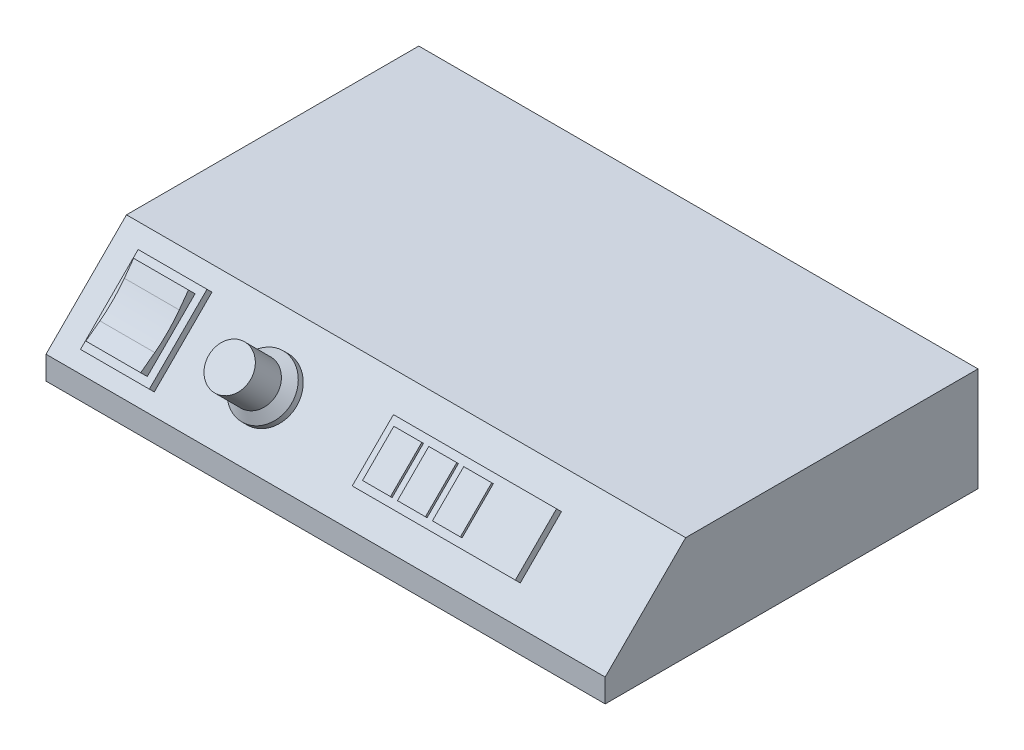
from build123d import *

# Parameters (mm, degrees)
BOSS_EXTRUDE1_DEPTH = 240
SKETCH2_W           = 70
SKETCH2_H           = 25
SKETCH2_W_2         = 29.546106777
SKETCH2_H_2         = 35
SKETCH2_R           = 12.5
BOSS_EXTRUDE2_DEPTH = 3
SKETCH3_R           = 9
BOSS_EXTRUDE3_DEPTH = 20
CHAMFER1_SIZE2      = 4.171137574
CHAMFER1_SIZE       = 3.5
SKETCH4_W           = 23.546106777
SKETCH4_H           = 29
BOSS_EXTRUDE4_DEPTH = 4
CUT_EXTRUDE1_DEPTH  = 27
SKETCH6_W           = 12
SKETCH6_H           = 19
BOSS_EXTRUDE5_DEPTH = 1


with BuildPart() as part:
    # Sketch1 → Boss-Extrude1 (new body)
    with BuildSketch(Plane(origin=(0, 0, 0), x_dir=(0, 0, -1), z_dir=(1, 0, 0))):
        Polygon((0, 0), (-66.758331831, 0), (-66.758331831, 10), (-32.219272119, 44.539059712), (93.241668169, 44.539059712), (93.241668169, 0), align=None)
    extrude(amount=BOSS_EXTRUDE1_DEPTH)

    # Sketch2 → Boss-Extrude2 (add)
    with BuildSketch(Plane(origin=(0, 38.379165915, 38.379165915), x_dir=(1, 0, 0), z_dir=(0, 0.7071067811865298, 0.7071067811865652))):
        with Locations((160.181803508, -15.788594651)):
            Rectangle(SKETCH2_W, SKETCH2_H)
        with Locations((27.103479103, -16.134201326)):
            Rectangle(SKETCH2_W_2, SKETCH2_H_2)
        with Locations(Location((77.833586966, -15.734201326, 0), (0, 0, 90))):
            Circle(SKETCH2_R)
    extrude(amount=BOSS_EXTRUDE2_DEPTH)

    # Sketch3 → Boss-Extrude3 (add)
    with BuildSketch(Plane(origin=(0, 40.500486259, 40.500486259), x_dir=(1, 0, 0), z_dir=(0, 0.7071067811865298, 0.7071067811865652))):
        with Locations(Location((77.833586966, -15.734201326, 0), (0, 0, 90))):
            Circle(SKETCH3_R)
    extrude(amount=BOSS_EXTRUDE3_DEPTH)

    # Chamfer1
    chamfer1_edges = [part.edges().sort_by_distance(p)[0] for p in [
        (77.833586966, 23.010764774, 57.990207744),
    ]]
    chamfer1_side = [part.faces().sort_by_distance(p)[0] for p in [
        (77.833586966, 22.961267299, 58.039705219),
    ]]
    chamfer(chamfer1_edges, length=CHAMFER1_SIZE - 0.0001, length2=CHAMFER1_SIZE2 - 0.0001, reference=chamfer1_side[0])  # a hair under: the kernel refuses the full size

    # Sketch4 → Boss-Extrude4 (add)
    with BuildSketch(Plane(origin=(0, 40.500486259, 40.500486259), x_dir=(1, 0, 0), z_dir=(0, 0.7071067811865298, 0.7071067811865652))):
        with Locations((27.103479102, -16.134201326)):
            Rectangle(SKETCH4_W, SKETCH4_H)
    extrude(amount=BOSS_EXTRUDE4_DEPTH)

    # Sketch5 → Cut-Extrude1 (cut)
    with BuildSketch(Plane.ZY.offset(-15.330425714)):
        with BuildLine():
            Line((44.484468223, 42.173358544), (48.455235169, 36.745535854))
            ThreePointArc((48.455235169, 36.745535854), (53.310708919, 31.055931968), (58.960608868, 26.154315063))
            Line((58.960608868, 26.154315063), (64.990564878, 21.66726189))
            Line((64.990564878, 21.66726189), (44.484468223, 42.173358544))
        make_face()
    extrude(amount=-CUT_EXTRUDE1_DEPTH, mode=Mode.SUBTRACT)

    # Sketch6 → Boss-Extrude5 (add)
    with BuildSketch(Plane(origin=(0, 40.500486259, 40.500486259), x_dir=(1, 0, 0), z_dir=(0, 0.7071067811865298, 0.7071067811865652))):
        with Locations((134.181803508, -15.788594651)):
            Rectangle(SKETCH6_W, SKETCH6_H)
        with Locations((149.181803508, -15.788594651)):
            Rectangle(SKETCH6_W, SKETCH6_H)
        with Locations((164.181803508, -15.788594651)):
            Rectangle(SKETCH6_W, SKETCH6_H)
    extrude(amount=BOSS_EXTRUDE5_DEPTH)


solid = part.part
